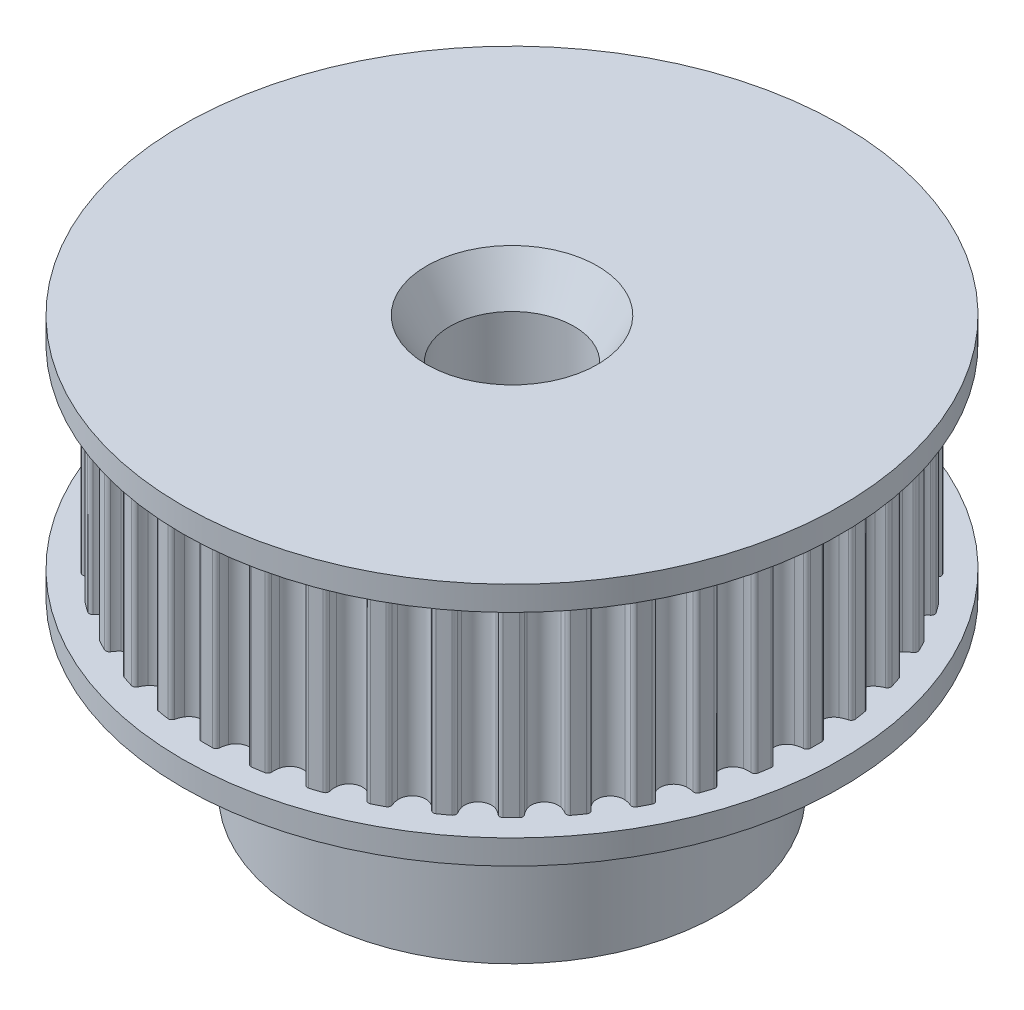
from build123d import *

# Parameters (mm, degrees)
SKETCH1_R               = 13.5
BOSS_EXTRUDE1_DEPTH     = 10
SKETCH6_R               = 8.5
BOSS_EXTRUDE2_DEPTH     = 7
CUT_EXTRUDE3_DEPTH      = 22.552262062
CUT_EXTRUDE3_DEPTH_BACK = 22.552262062
SKETCH4_R               = 2.54
CUT_EXTRUDE1_DEPTH      = 8
CIRPATTERN1_COUNT       = 40
SKETCH7_R               = 1.25
CUT_EXTRUDE4_DEPTH      = 22.552262062
SKETCH8_R               = 1.25
CUT_EXTRUDE5_DEPTH      = 22.552262062


with BuildPart() as part:
    # Sketch1 → Boss-Extrude1 (new body)
    with BuildSketch(Plane(origin=(0, 0, 0), x_dir=(1, 0, 0), z_dir=(0, 1, 0))):
        Circle(SKETCH1_R)
    extrude(amount=BOSS_EXTRUDE1_DEPTH)

    # Sketch6 → Boss-Extrude2 (add)
    with BuildSketch(Plane(origin=(0, 0, 0), x_dir=(1, 0, 0), z_dir=(0, 1, 0))):
        Circle(SKETCH6_R)
    extrude(amount=-BOSS_EXTRUDE2_DEPTH)

    # Sketch4 → Cut-Extrude3 (cut, two sides: drawn at the far end of the back side and taken through both)
    with BuildSketch(Plane(origin=(0, 0, 0), x_dir=(1, 0, 0), z_dir=(0, 1, 0)).offset(-CUT_EXTRUDE3_DEPTH_BACK)):
        Circle(SKETCH4_R)
    extrude(amount=CUT_EXTRUDE3_DEPTH + CUT_EXTRUDE3_DEPTH_BACK, mode=Mode.SUBTRACT)

    # Sketch2 → Cut-Extrude1 (cut)
    with BuildSketch(Plane(origin=(0, 1, 0), x_dir=(1, 0, 0), z_dir=(0, 1, 0))):
        with BuildLine():
            Line((0, 12.48), (0, 13.826261798))
            ThreePointArc((0, 13.826261798), (1.1066884, 13.781899583), (2.206275075, 13.649097612))
            Line((2.206275075, 13.649097612), (1.99145028, 12.320086273))
            ThreePointArc((1.99145028, 12.320086273), (1.866164383, 12.339685186), (1.740685811, 12.358010071))
            ThreePointArc((1.740685811, 12.358010071), (1.63501831, 12.33324281), (1.573716318, 12.243682194))
            ThreePointArc((1.573716318, 12.243682194), (1.528147474, 12.09934832), (1.461317373, 11.963545064))
            ThreePointArc((1.461317373, 11.963545064), (0.938898389, 11.692363739), (0.46644624, 12.04343335))
            ThreePointArc((0.46644624, 12.04343335), (0.422142779, 12.188160646), (0.400189386, 12.337916566))
            ThreePointArc((0.400189386, 12.337916566), (0.3539642, 12.436111628), (0.253602825, 12.477423036))
            ThreePointArc((0.253602825, 12.477423036), (0.126807959, 12.479355742), (0, 12.48))
        make_face()
    cut_extrude1 = extrude(amount=CUT_EXTRUDE1_DEPTH, mode=Mode.SUBTRACT)

    # CirPattern1: Cut-Extrude1 ×40 about axis
    cirpattern1_axis = Axis((0, 10, 0), (0, -1, 0))
    for i in range(1, CIRPATTERN1_COUNT):
        add(cut_extrude1.rotate(cirpattern1_axis, i * 360 / CIRPATTERN1_COUNT), mode=Mode.SUBTRACT)

    # Sketch5 → Cut-Revolve1 (revolve, cut)
    with BuildSketch(Plane.XY):
        Polygon((-3.5, 10), (0, 10), (0, 6.124394972), (-1.262418394, 6.124394972), align=None)
        Polygon((-3.5, -7), (0, -7), (0, -4.128474964), (-0.628474964, -4.128474964), align=None)
    revolve(axis=Axis((0, 10, 0), (0, -1, 0)), mode=Mode.SUBTRACT)

    # Sketch7 → Cut-Extrude4 (cut, through all)
    with BuildSketch(Plane.XY):
        with Locations((0, -3.5)):
            Circle(SKETCH7_R)
    extrude(amount=-CUT_EXTRUDE4_DEPTH, mode=Mode.SUBTRACT)

    # Sketch8 → Cut-Extrude5 (cut, through all)
    with BuildSketch(Plane(origin=(0, 0, 0), x_dir=(0, 0, -1), z_dir=(1, 0, 0))):
        with Locations((0, -3.5)):
            Circle(SKETCH8_R)
    extrude(amount=-CUT_EXTRUDE5_DEPTH, mode=Mode.SUBTRACT)


solid = part.part
